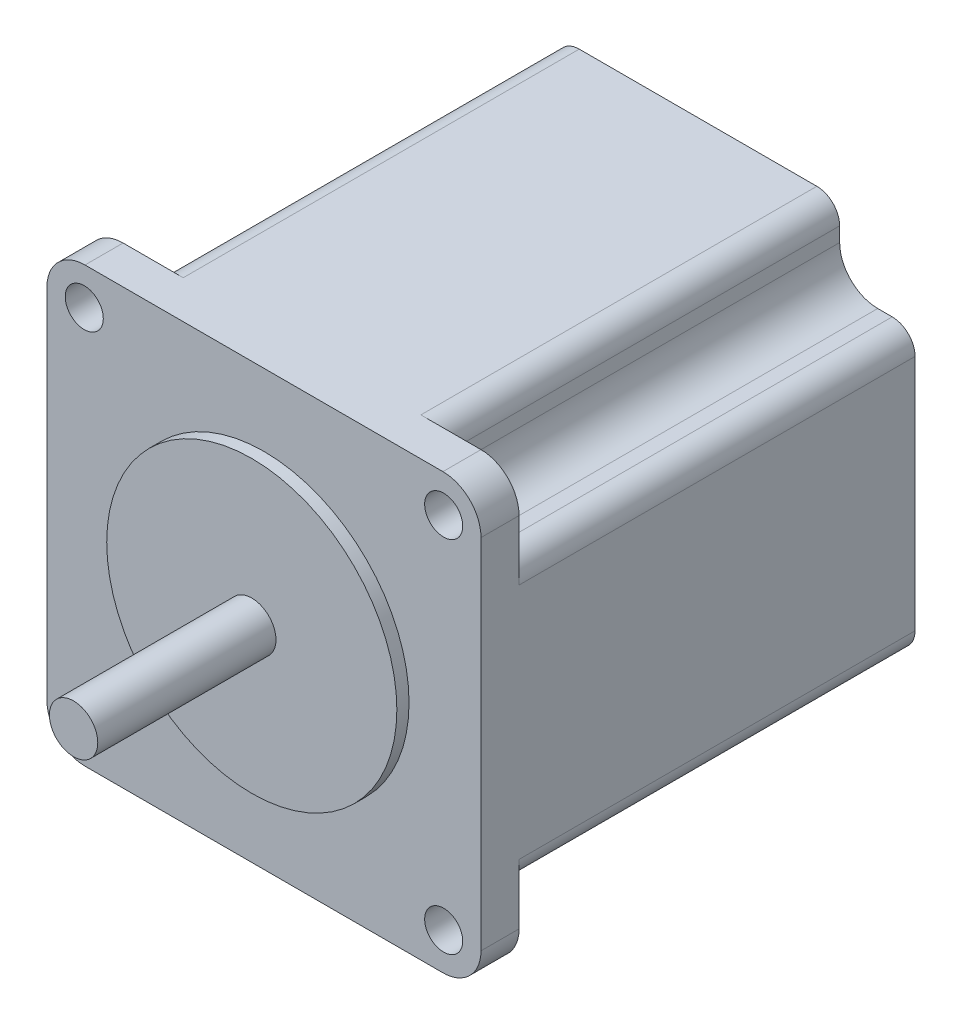
from build123d import *

# Parameters (mm, degrees)
BOSS_EXTRUDE1_DEPTH = 2.5
SKETCH5_R           = 2.5
CUT_EXTRUDE1_DEPTH  = 41.614036982
SKETCH2_R           = 3.175
BOSS_EXTRUDE2_DEPTH = 25
SKETCH3_R           = 19.05
BOSS_EXTRUDE3_DEPTH = 1.6
BOSS_EXTRUDE4_DEPTH = 52


with BuildPart() as part:
    # Sketch1 → Boss-Extrude1 (new, symmetric)
    with BuildSketch(Plane.XY):
        with BuildLine():
            Line((-23.5, -28.5), (23.5, -28.5))
            ThreePointArc((23.5, -28.5), (27.035533906, -27.035533906), (28.5, -23.5))
            Line((28.5, -23.5), (28.5, 23.5))
            ThreePointArc((28.5, 23.5), (27.035533906, 27.035533906), (23.5, 28.5))
            Line((23.5, 28.5), (-23.5, 28.5))
            ThreePointArc((-23.5, 28.5), (-27.035533906, 27.035533906), (-28.5, 23.5))
            Line((-28.5, 23.5), (-28.5, -23.5))
            ThreePointArc((-28.5, -23.5), (-27.035533906, -27.035533906), (-23.5, -28.5))
        make_face()
    extrude(amount=BOSS_EXTRUDE1_DEPTH, both=True)

    # Sketch5 → Cut-Extrude1 (cut, through all)
    with BuildSketch(Plane.XY.offset(2.5)):
        with Locations((-23.6, 23.6)):
            Circle(SKETCH5_R)
        with Locations((23.6, 23.6)):
            Circle(SKETCH5_R)
        with Locations((23.6, -23.6)):
            Circle(SKETCH5_R)
        with Locations((-23.6, -23.6)):
            Circle(SKETCH5_R)
    extrude(amount=-CUT_EXTRUDE1_DEPTH, mode=Mode.SUBTRACT)

    # Sketch2 → Boss-Extrude2 (add)
    with BuildSketch(Plane.XY.offset(2.5)):
        Circle(SKETCH2_R)
    extrude(amount=BOSS_EXTRUDE2_DEPTH)

    # Sketch3 → Boss-Extrude3 (add)
    with BuildSketch(Plane.XY.offset(2.5)):
        Circle(SKETCH3_R)
    extrude(amount=BOSS_EXTRUDE3_DEPTH)

    # Sketch4 → Boss-Extrude4 (add)
    with BuildSketch(Plane(origin=(0, 0, -2.5), x_dir=(-1, 0, 0), z_dir=(0, 0, -1))):
        with BuildLine():
            Line((-18.6, 23.6), (-18.6, 25.5))
            ThreePointArc((-18.6, 25.5), (-17.721320344, 27.621320344), (-15.6, 28.5))
            Line((-15.6, 28.5), (15.6, 28.5))
            ThreePointArc((15.6, 28.5), (17.721320344, 27.621320344), (18.6, 25.5))
            Line((18.6, 25.5), (18.6, 23.6))
            ThreePointArc((18.6, 23.6), (20.064466094, 20.064466094), (23.6, 18.6))
            Line((23.6, 18.6), (25.5, 18.6))
            ThreePointArc((25.5, 18.6), (27.621320344, 17.721320344), (28.5, 15.6))
            Line((28.5, 15.6), (28.5, -15.6))
            ThreePointArc((28.5, -15.6), (27.621320344, -17.721320344), (25.5, -18.6))
            Line((25.5, -18.6), (23.6, -18.6))
            ThreePointArc((23.6, -18.6), (20.064466094, -20.064466094), (18.6, -23.6))
            Line((18.6, -23.6), (18.6, -25.5))
            ThreePointArc((18.6, -25.5), (17.721320344, -27.621320344), (15.6, -28.5))
            Line((15.6, -28.5), (-15.6, -28.5))
            ThreePointArc((-15.6, -28.5), (-17.721320344, -27.621320344), (-18.6, -25.5))
            Line((-18.6, -25.5), (-18.6, -23.6))
            ThreePointArc((-18.6, -23.6), (-20.064466094, -20.064466094), (-23.6, -18.6))
            Line((-23.6, -18.6), (-25.5, -18.6))
            ThreePointArc((-25.5, -18.6), (-27.621320344, -17.721320344), (-28.5, -15.6))
            Line((-28.5, -15.6), (-28.5, 15.6))
            ThreePointArc((-28.5, 15.6), (-27.621320344, 17.721320344), (-25.5, 18.6))
            Line((-25.5, 18.6), (-23.6, 18.6))
            ThreePointArc((-23.6, 18.6), (-20.064466094, 20.064466094), (-18.6, 23.6))
        make_face()
    extrude(amount=BOSS_EXTRUDE4_DEPTH)


solid = part.part
